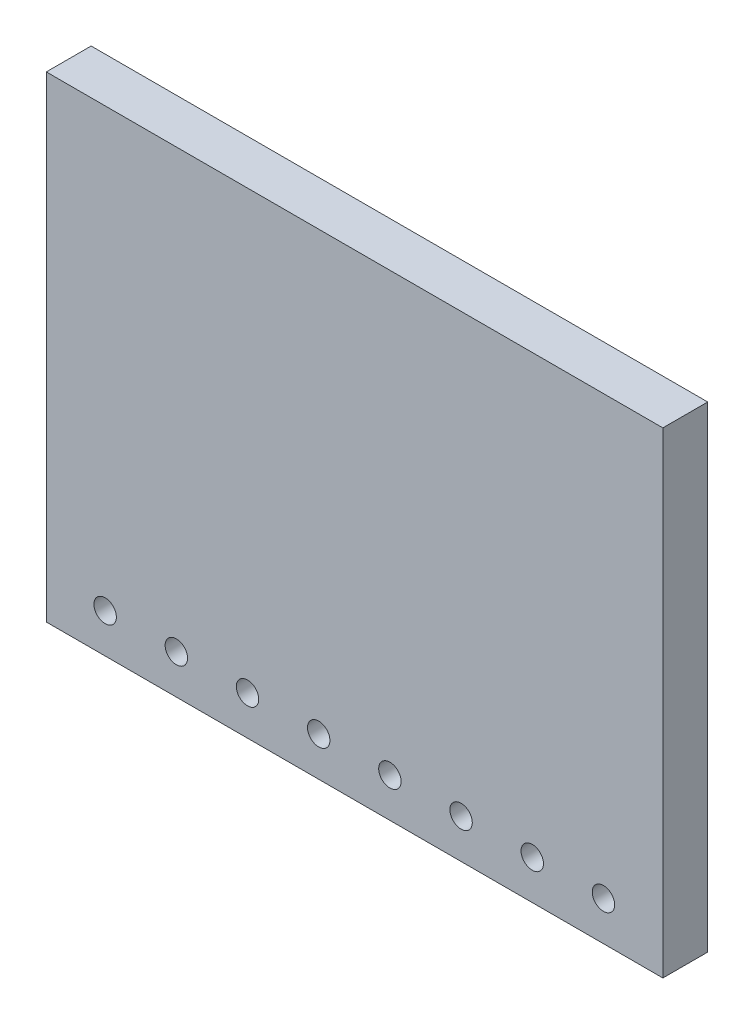
from build123d import *

# Parameters (mm, degrees)
SKETCH1_W           = 22
SKETCH1_H           = 17
BOSS_EXTRUDE1_DEPTH = 1.6
CUT_EXTRUDE1_REACH  = 15.993
SKETCH2_R           = 0.4


with BuildPart() as part:
    # Sketch1 → Boss-Extrude1 (new body)
    with BuildSketch(Plane.XY):
        Rectangle(SKETCH1_W, SKETCH1_H)
    extrude(amount=BOSS_EXTRUDE1_DEPTH)

    # Sketch2 → Cut-Extrude1 (cut, up to next)
    with BuildSketch(Plane.XY.offset(1.6), mode=Mode.PRIVATE) as cut_extrude1_sk1:
        with Locations((-8.9, -7.1)):
            Circle(SKETCH2_R)
    cut_extrude1_tool1 = extrude(cut_extrude1_sk1.sketch, amount=-CUT_EXTRUDE1_REACH, mode=Mode.PRIVATE) & part.part
    # Sketch2 → Cut-Extrude1 (cut, up to next)
    with BuildSketch(Plane.XY.offset(1.6), mode=Mode.PRIVATE) as cut_extrude1_sk2:
        with Locations((-6.36, -7.1)):
            Circle(SKETCH2_R)
    cut_extrude1_tool2 = extrude(cut_extrude1_sk2.sketch, amount=-CUT_EXTRUDE1_REACH, mode=Mode.PRIVATE) & part.part
    # Sketch2 → Cut-Extrude1 (cut, up to next)
    with BuildSketch(Plane.XY.offset(1.6), mode=Mode.PRIVATE) as cut_extrude1_sk3:
        with Locations((-3.82, -7.1)):
            Circle(SKETCH2_R)
    cut_extrude1_tool3 = extrude(cut_extrude1_sk3.sketch, amount=-CUT_EXTRUDE1_REACH, mode=Mode.PRIVATE) & part.part
    # Sketch2 → Cut-Extrude1 (cut, up to next)
    with BuildSketch(Plane.XY.offset(1.6), mode=Mode.PRIVATE) as cut_extrude1_sk4:
        with Locations((-1.28, -7.1)):
            Circle(SKETCH2_R)
    cut_extrude1_tool4 = extrude(cut_extrude1_sk4.sketch, amount=-CUT_EXTRUDE1_REACH, mode=Mode.PRIVATE) & part.part
    # Sketch2 → Cut-Extrude1 (cut, up to next)
    with BuildSketch(Plane.XY.offset(1.6), mode=Mode.PRIVATE) as cut_extrude1_sk5:
        with Locations((1.26, -7.1)):
            Circle(SKETCH2_R)
    cut_extrude1_tool5 = extrude(cut_extrude1_sk5.sketch, amount=-CUT_EXTRUDE1_REACH, mode=Mode.PRIVATE) & part.part
    # Sketch2 → Cut-Extrude1 (cut, up to next)
    with BuildSketch(Plane.XY.offset(1.6), mode=Mode.PRIVATE) as cut_extrude1_sk6:
        with Locations((3.8, -7.1)):
            Circle(SKETCH2_R)
    cut_extrude1_tool6 = extrude(cut_extrude1_sk6.sketch, amount=-CUT_EXTRUDE1_REACH, mode=Mode.PRIVATE) & part.part
    # Sketch2 → Cut-Extrude1 (cut, up to next)
    with BuildSketch(Plane.XY.offset(1.6), mode=Mode.PRIVATE) as cut_extrude1_sk7:
        with Locations((6.34, -7.1)):
            Circle(SKETCH2_R)
    cut_extrude1_tool7 = extrude(cut_extrude1_sk7.sketch, amount=-CUT_EXTRUDE1_REACH, mode=Mode.PRIVATE) & part.part
    # Sketch2 → Cut-Extrude1 (cut, up to next)
    with BuildSketch(Plane.XY.offset(1.6), mode=Mode.PRIVATE) as cut_extrude1_sk8:
        with Locations((8.88, -7.1)):
            Circle(SKETCH2_R)
    cut_extrude1_tool8 = extrude(cut_extrude1_sk8.sketch, amount=-CUT_EXTRUDE1_REACH, mode=Mode.PRIVATE) & part.part
    add(cut_extrude1_tool1.solids().sort_by_distance((-8.9, -7.1, 1.6))[0], mode=Mode.SUBTRACT)
    add(cut_extrude1_tool2.solids().sort_by_distance((-6.36, -7.1, 1.6))[0], mode=Mode.SUBTRACT)
    add(cut_extrude1_tool3.solids().sort_by_distance((-3.82, -7.1, 1.6))[0], mode=Mode.SUBTRACT)
    add(cut_extrude1_tool4.solids().sort_by_distance((-1.28, -7.1, 1.6))[0], mode=Mode.SUBTRACT)
    add(cut_extrude1_tool5.solids().sort_by_distance((1.26, -7.1, 1.6))[0], mode=Mode.SUBTRACT)
    add(cut_extrude1_tool6.solids().sort_by_distance((3.8, -7.1, 1.6))[0], mode=Mode.SUBTRACT)
    add(cut_extrude1_tool7.solids().sort_by_distance((6.34, -7.1, 1.6))[0], mode=Mode.SUBTRACT)
    add(cut_extrude1_tool8.solids().sort_by_distance((8.88, -7.1, 1.6))[0], mode=Mode.SUBTRACT)


solid = part.part
